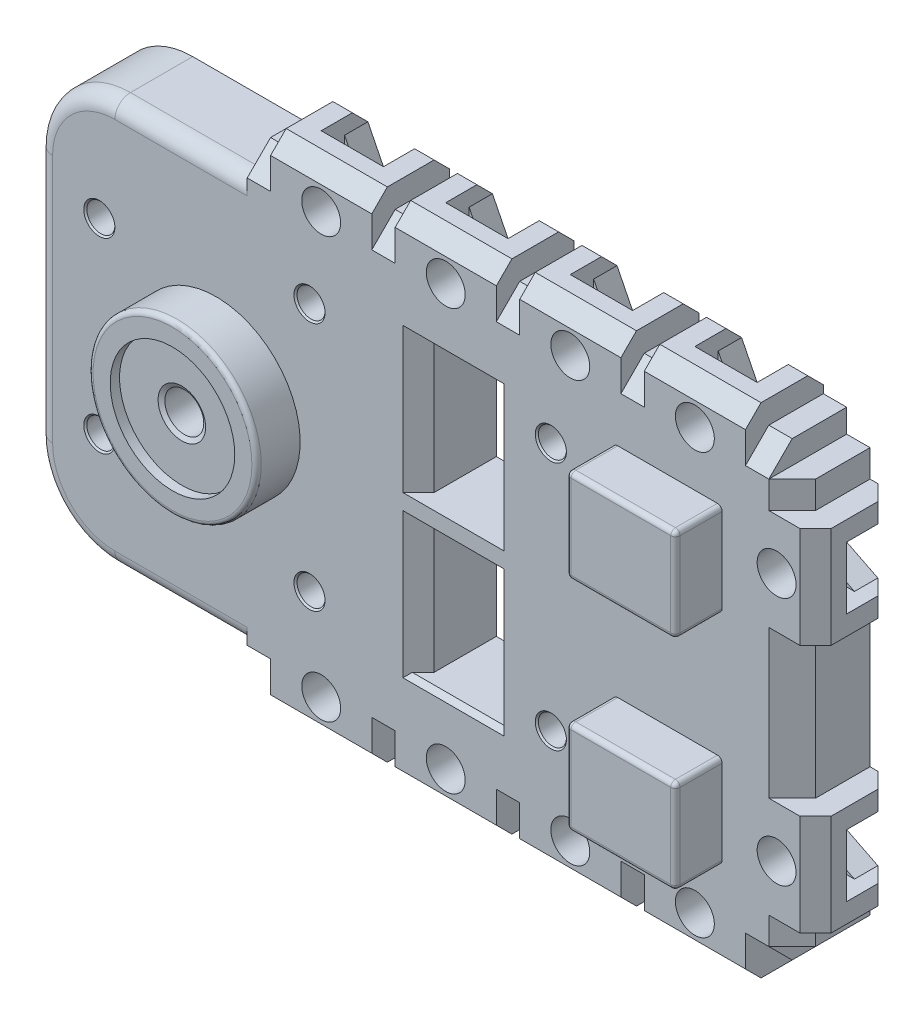
from build123d import *

# Parameters (mm, degrees)
BOSS_EXTRUDE1_DEPTH                  = 2.5
SKETCH5_W                            = 7
SKETCH5_H                            = 6
BOSS_EXTRUDE3_DEPTH                  = 3
SKETCH6_W                            = 3
SKETCH6_H                            = 4
CUT_EXTRUDE3_DEPTH                   = 1
CUT_EXTRUDE4_DEPTH                   = 1.5
CUT_EXTRUDE5_REACH                   = 44.453
SKETCH10_W                           = 4
SKETCH10_H                           = 3
CUT_EXTRUDE6_DEPTH                   = 1
CUT_EXTRUDE7_DEPTH                   = 1.5
CUT_EXTRUDE8_REACH                   = 44.453
CUT_EXTRUDE9_REACH                   = 43.991
SKETCH13_R                           = 1.25
CUT_EXTRUDE10_REACH                  = 43.991
SKETCH14_R                           = 1.25
LPATTERN1_COUNT                      = 4
LPATTERN1_PITCH                      = 8
MIRROR1_COPY_1_SKETCH_W              = 4
MIRROR1_COPY_1_SKETCH_H              = 3
MIRROR1_COPY_1_DEPTH                 = 1
MIRROR1_COPY_2_SKETCH_W              = 4
MIRROR1_COPY_2_SKETCH_H              = 3
MIRROR1_COPY_2_DEPTH                 = 1
MIRROR1_COPY_3_SKETCH_W              = 4
MIRROR1_COPY_3_SKETCH_H              = 3
MIRROR1_COPY_3_DEPTH                 = 1
MIRROR1_COPY_4_DEPTH                 = 1.5
MIRROR1_COPY_5_DEPTH                 = 1.5
MIRROR1_COPY_6_DEPTH                 = 1.5
MIRROR1_COPY_7_REACH                 = 44.453
MIRROR1_COPY_8_REACH                 = 44.453
MIRROR1_COPY_9_REACH                 = 44.453
MIRROR1_COPY_10_REACH                = 43.991
MIRROR1_COPY_10_SKETCH_R             = 1.25
MIRROR1_COPY_11_REACH                = 43.991
MIRROR1_COPY_11_SKETCH_R             = 1.25
MIRROR1_COPY_12_REACH                = 43.991
MIRROR1_COPY_12_SKETCH_R             = 1.25
FILLET1_R                            = 5
SKETCH2_W                            = 4.5
SKETCH2_H                            = 9
CUT_EXTRUDE1_DEPTH                   = 42.991070479
SKETCH3_R                            = 5.4
BOSS_EXTRUDE4_DEPTH                  = 2.8
SKETCH17_R                           = 4
CUT_EXTRUDE13_DEPTH                  = 0.6
F_1_6_1_6_DIAMETER_HOLE1_D           = 1.6
F_1_6_1_6_DIAMETER_HOLE1_DEPTH       = 4.5
F_1_6_1_6_DIAMETER_HOLE1_CSINK_D     = 1.8
F_1_6_1_6_DIAMETER_HOLE1_CSINK_ANGLE = 120
F_1_6_1_6_DIAMETER_HOLE1_TIP         = 0.480688495
M3_TAPPED_HOLE1_D                    = 2.5
M3_TAPPED_HOLE1_CSINK_D              = 3.05
M3_TAPPED_HOLE1_CSINK_ANGLE          = 120
F_1_8_1_8_DIAMETER_HOLE1_D           = 1.8
F_1_8_1_8_DIAMETER_HOLE1_CSINK_D     = 2
F_1_8_1_8_DIAMETER_HOLE1_CSINK_ANGLE = 90
FILLET2_R                            = 1
CHAMFER1_SIZE                        = 1
CHAMFER2_SIZE                        = 1.5
CHAMFER3_SIZE                        = 1
CHAMFER4_SIZE                        = 0.3
FILLET3_R                            = 0.3


with BuildPart() as part:
    # Sketch1 → Boss-Extrude1 (new, symmetric)
    with BuildSketch(Plane.XY):
        Polygon((37, -13), (35.5, -13), (35.5, -14.5), (34, -14.5), (34, -16), (27.5, -16), (27.5, -14.5), (26, -14.5), (26, -16), (19.5, -16), (19.5, -14.5), (18, -14.5), (18, -16), (11.5, -16), (11.5, -14.5), (10, -14.5), (10, -16), (3.5, -16), (3.5, -14.5), (2, -14.5), (2, -13), (-11.5, -13), (-11.5, 13), (2, 13), (2, 14.5), (3.5, 14.5), (3.5, 16), (10, 16), (10, 14.5), (11.5, 14.5), (11.5, 16), (18, 16), (18, 14.5), (19.5, 14.5), (19.5, 16), (26, 16), (26, 14.5), (27.5, 14.5), (27.5, 16), (34, 16), (34, 14.5), (35.5, 14.5), (35.5, 13), (37, 13), (37, 11.25), (38.5, 11.25), (38.5, 4.75), (37, 4.75), (37, -4.75), (38.5, -4.75), (38.5, -11.25), (37, -11.25), align=None)
    extrude(amount=BOSS_EXTRUDE1_DEPTH, both=True)

    # Sketch5 → Boss-Extrude3 (add)
    with BuildSketch(Plane.XY.offset(2.5)):
        with Locations((29, 7)):
            Rectangle(SKETCH5_W, SKETCH5_H)
        with Locations((29, -7)):
            Rectangle(SKETCH5_W, SKETCH5_H)
    extrude(amount=BOSS_EXTRUDE3_DEPTH)

    # Sketch6 → Cut-Extrude3 (cut)
    with BuildSketch(Plane(origin=(38.5, 0, 0), x_dir=(0, 0, -1), z_dir=(1, 0, 0))):
        with Locations((1, 8)):
            Rectangle(SKETCH6_W, SKETCH6_H)
    cut_extrude3 = extrude(amount=-CUT_EXTRUDE3_DEPTH, mode=Mode.SUBTRACT)

    # Sketch7 → Cut-Extrude4 (cut)
    with BuildSketch(Plane(origin=(0, 0, 0.5), x_dir=(-1, 0, 0), z_dir=(0, 0, -1))):
        Polygon((-37.154700538, 6), (-34.845299462, 6), (-33.690598923, 8), (-34.845299462, 10), (-37.154700538, 10), (-38.5, 10), (-38.5, 6), align=None)
    cut_extrude4 = extrude(amount=CUT_EXTRUDE4_DEPTH, mode=Mode.SUBTRACT)

    # Sketch8 → Cut-Extrude5 (cut, up to next)
    with BuildSketch(Plane(origin=(0, 0, -2.5), x_dir=(-1, 0, 0), z_dir=(0, 0, -1)), mode=Mode.PRIVATE) as cut_extrude5_sk1:
        Polygon((-37.5, 10), (-35.5, 9), (-35.5, 7), (-37.5, 6), align=None)
    cut_extrude5_tool1 = extrude(cut_extrude5_sk1.sketch, amount=-CUT_EXTRUDE5_REACH, mode=Mode.PRIVATE) & part.part
    cut_extrude5 = cut_extrude5_tool1.solids().sort_by_distance((36.611111, 8, -2.5))[0]
    add(cut_extrude5, mode=Mode.SUBTRACT)

    # Sketch10 → Cut-Extrude6 (cut)
    with BuildSketch(Plane(origin=(0, 16, 0), x_dir=(1, 0, 0), z_dir=(0, 1, 0))):
        with Locations((30.75, 1)):
            Rectangle(SKETCH10_W, SKETCH10_H)
    cut_extrude6 = extrude(amount=-CUT_EXTRUDE6_DEPTH, mode=Mode.SUBTRACT)

    # Sketch11 → Cut-Extrude7 (cut)
    with BuildSketch(Plane(origin=(0, 0, 0.5), x_dir=(-1, 0, 0), z_dir=(0, 0, -1))):
        Polygon((-32.75, 14.654700538), (-32.75, 12.345299462), (-30.75, 11.190598923), (-28.75, 12.345299462), (-28.75, 14.654700538), (-28.75, 16), (-32.75, 16), align=None)
    cut_extrude7 = extrude(amount=CUT_EXTRUDE7_DEPTH, mode=Mode.SUBTRACT)

    # Sketch12 → Cut-Extrude8 (cut, up to next)
    with BuildSketch(Plane(origin=(0, 0, -2.5), x_dir=(-1, 0, 0), z_dir=(0, 0, -1)), mode=Mode.PRIVATE) as cut_extrude8_sk1:
        Polygon((-28.75, 15), (-29.75, 13), (-31.75, 13), (-32.75, 15), align=None)
    cut_extrude8_tool1 = extrude(cut_extrude8_sk1.sketch, amount=-CUT_EXTRUDE8_REACH, mode=Mode.PRIVATE) & part.part
    cut_extrude8 = cut_extrude8_tool1.solids().sort_by_distance((30.75, 14.111111, -2.5))[0]
    add(cut_extrude8, mode=Mode.SUBTRACT)

    # Sketch13 → Cut-Extrude9 (cut, up to next)
    with BuildSketch(Plane.XY.offset(2.5), mode=Mode.PRIVATE) as cut_extrude9_sk1:
        with Locations((36, 8)):
            Circle(SKETCH13_R)
    cut_extrude9_tool1 = extrude(cut_extrude9_sk1.sketch, amount=-CUT_EXTRUDE9_REACH, mode=Mode.PRIVATE) & part.part
    cut_extrude9 = cut_extrude9_tool1.solids().sort_by_distance((36, 8, 2.5))[0]
    add(cut_extrude9, mode=Mode.SUBTRACT)

    # Sketch14 → Cut-Extrude10 (cut, up to next)
    with BuildSketch(Plane.XY.offset(2.5), mode=Mode.PRIVATE) as cut_extrude10_sk1:
        with Locations((30.75, 13.5)):
            Circle(SKETCH14_R)
    cut_extrude10_tool1 = extrude(cut_extrude10_sk1.sketch, amount=-CUT_EXTRUDE10_REACH, mode=Mode.PRIVATE) & part.part
    cut_extrude10 = cut_extrude10_tool1.solids().sort_by_distance((30.75, 13.5, 2.5))[0]
    add(cut_extrude10, mode=Mode.SUBTRACT)

    # LPattern1: Cut-Extrude6, Cut-Extrude7, Cut-Extrude8, Cut-Extrude10 ×4
    with Locations(*[(-i * LPATTERN1_PITCH, 0, 0) for i in range(1, LPATTERN1_COUNT)]):
        add(cut_extrude6, mode=Mode.SUBTRACT)
        add(cut_extrude7, mode=Mode.SUBTRACT)
        add(cut_extrude8, mode=Mode.SUBTRACT)
        add(cut_extrude10, mode=Mode.SUBTRACT)

    # Mirror1: Cut-Extrude3, Cut-Extrude4, Cut-Extrude5, Cut-Extrude6, Cut-Extrude7, Cut-Extrude8, Cut-Extrude9, Cut-Extrude10 across plane
    add(cut_extrude3.mirror(Plane.ZX), mode=Mode.SUBTRACT)
    add(cut_extrude4.mirror(Plane.ZX), mode=Mode.SUBTRACT)
    add(cut_extrude5.mirror(Plane.ZX), mode=Mode.SUBTRACT)
    add(cut_extrude6.mirror(Plane.ZX), mode=Mode.SUBTRACT)
    add(cut_extrude7.mirror(Plane.ZX), mode=Mode.SUBTRACT)
    add(cut_extrude8.mirror(Plane.ZX), mode=Mode.SUBTRACT)
    add(cut_extrude9.mirror(Plane.ZX), mode=Mode.SUBTRACT)
    add(cut_extrude10.mirror(Plane.ZX), mode=Mode.SUBTRACT)

    # Mirror1 copy 1 sketch → Mirror1 copy 1 (cut)
    with BuildSketch(Plane(origin=(-8, -16, 0), x_dir=(1, 0, 0), z_dir=(0, -1, 0))):
        with Locations((30.75, -1)):
            Rectangle(MIRROR1_COPY_1_SKETCH_W, MIRROR1_COPY_1_SKETCH_H)
    extrude(amount=-MIRROR1_COPY_1_DEPTH, mode=Mode.SUBTRACT)

    # Mirror1 copy 2 sketch → Mirror1 copy 2 (cut)
    with BuildSketch(Plane(origin=(-16, -16, 0), x_dir=(1, 0, 0), z_dir=(0, -1, 0))):
        with Locations((30.75, -1)):
            Rectangle(MIRROR1_COPY_2_SKETCH_W, MIRROR1_COPY_2_SKETCH_H)
    extrude(amount=-MIRROR1_COPY_2_DEPTH, mode=Mode.SUBTRACT)

    # Mirror1 copy 3 sketch → Mirror1 copy 3 (cut)
    with BuildSketch(Plane(origin=(-24, -16, 0), x_dir=(1, 0, 0), z_dir=(0, -1, 0))):
        with Locations((30.75, -1)):
            Rectangle(MIRROR1_COPY_3_SKETCH_W, MIRROR1_COPY_3_SKETCH_H)
    extrude(amount=-MIRROR1_COPY_3_DEPTH, mode=Mode.SUBTRACT)

    # Mirror1 copy 4 sketch → Mirror1 copy 4 (cut)
    with BuildSketch(Plane(origin=(-8, 0, 0.5), x_dir=(-1, 0, 0), z_dir=(0, 0, -1))):
        Polygon((-32.75, -14.654700538), (-32.75, -12.345299462), (-30.75, -11.190598923), (-28.75, -12.345299462), (-28.75, -14.654700538), (-28.75, -16), (-32.75, -16), align=None)
    extrude(amount=MIRROR1_COPY_4_DEPTH, mode=Mode.SUBTRACT)

    # Mirror1 copy 5 sketch → Mirror1 copy 5 (cut)
    with BuildSketch(Plane(origin=(-16, 0, 0.5), x_dir=(-1, 0, 0), z_dir=(0, 0, -1))):
        Polygon((-32.75, -14.654700538), (-32.75, -12.345299462), (-30.75, -11.190598923), (-28.75, -12.345299462), (-28.75, -14.654700538), (-28.75, -16), (-32.75, -16), align=None)
    extrude(amount=MIRROR1_COPY_5_DEPTH, mode=Mode.SUBTRACT)

    # Mirror1 copy 6 sketch → Mirror1 copy 6 (cut)
    with BuildSketch(Plane(origin=(-24, 0, 0.5), x_dir=(-1, 0, 0), z_dir=(0, 0, -1))):
        Polygon((-32.75, -14.654700538), (-32.75, -12.345299462), (-30.75, -11.190598923), (-28.75, -12.345299462), (-28.75, -14.654700538), (-28.75, -16), (-32.75, -16), align=None)
    extrude(amount=MIRROR1_COPY_6_DEPTH, mode=Mode.SUBTRACT)

    # Mirror1 copy 7 sketch → Mirror1 copy 7 (cut, up to next)
    with BuildSketch(Plane(origin=(-8, 0, -2.5), x_dir=(-1, 0, 0), z_dir=(0, 0, -1)), mode=Mode.PRIVATE) as mirror1_copy_7_sk1:
        Polygon((-28.75, -15), (-29.75, -13), (-31.75, -13), (-32.75, -15), align=None)
    mirror1_copy_7_tool1 = extrude(mirror1_copy_7_sk1.sketch, amount=-MIRROR1_COPY_7_REACH, mode=Mode.PRIVATE) & part.part
    add(mirror1_copy_7_tool1.solids().sort_by_distance((22.75, -14.111111, -2.5))[0], mode=Mode.SUBTRACT)

    # Mirror1 copy 8 sketch → Mirror1 copy 8 (cut, up to next)
    with BuildSketch(Plane(origin=(-16, 0, -2.5), x_dir=(-1, 0, 0), z_dir=(0, 0, -1)), mode=Mode.PRIVATE) as mirror1_copy_8_sk1:
        Polygon((-28.75, -15), (-29.75, -13), (-31.75, -13), (-32.75, -15), align=None)
    mirror1_copy_8_tool1 = extrude(mirror1_copy_8_sk1.sketch, amount=-MIRROR1_COPY_8_REACH, mode=Mode.PRIVATE) & part.part
    add(mirror1_copy_8_tool1.solids().sort_by_distance((14.75, -14.111111, -2.5))[0], mode=Mode.SUBTRACT)

    # Mirror1 copy 9 sketch → Mirror1 copy 9 (cut, up to next)
    with BuildSketch(Plane(origin=(-24, 0, -2.5), x_dir=(-1, 0, 0), z_dir=(0, 0, -1)), mode=Mode.PRIVATE) as mirror1_copy_9_sk1:
        Polygon((-28.75, -15), (-29.75, -13), (-31.75, -13), (-32.75, -15), align=None)
    mirror1_copy_9_tool1 = extrude(mirror1_copy_9_sk1.sketch, amount=-MIRROR1_COPY_9_REACH, mode=Mode.PRIVATE) & part.part
    add(mirror1_copy_9_tool1.solids().sort_by_distance((6.75, -14.111111, -2.5))[0], mode=Mode.SUBTRACT)

    # Mirror1 copy 10 sketch → Mirror1 copy 10 (cut, up to next)
    with BuildSketch(Plane(origin=(-8, 0, 2.5), x_dir=(1, 0, 0), z_dir=(0, 0, 1)), mode=Mode.PRIVATE) as mirror1_copy_10_sk1:
        with Locations((30.75, -13.5)):
            Circle(MIRROR1_COPY_10_SKETCH_R)
    mirror1_copy_10_tool1 = extrude(mirror1_copy_10_sk1.sketch, amount=-MIRROR1_COPY_10_REACH, mode=Mode.PRIVATE) & part.part
    add(mirror1_copy_10_tool1.solids().sort_by_distance((22.75, -13.5, 2.5))[0], mode=Mode.SUBTRACT)

    # Mirror1 copy 11 sketch → Mirror1 copy 11 (cut, up to next)
    with BuildSketch(Plane(origin=(-16, 0, 2.5), x_dir=(1, 0, 0), z_dir=(0, 0, 1)), mode=Mode.PRIVATE) as mirror1_copy_11_sk1:
        with Locations((30.75, -13.5)):
            Circle(MIRROR1_COPY_11_SKETCH_R)
    mirror1_copy_11_tool1 = extrude(mirror1_copy_11_sk1.sketch, amount=-MIRROR1_COPY_11_REACH, mode=Mode.PRIVATE) & part.part
    add(mirror1_copy_11_tool1.solids().sort_by_distance((14.75, -13.5, 2.5))[0], mode=Mode.SUBTRACT)

    # Mirror1 copy 12 sketch → Mirror1 copy 12 (cut, up to next)
    with BuildSketch(Plane(origin=(-24, 0, 2.5), x_dir=(1, 0, 0), z_dir=(0, 0, 1)), mode=Mode.PRIVATE) as mirror1_copy_12_sk1:
        with Locations((30.75, -13.5)):
            Circle(MIRROR1_COPY_12_SKETCH_R)
    mirror1_copy_12_tool1 = extrude(mirror1_copy_12_sk1.sketch, amount=-MIRROR1_COPY_12_REACH, mode=Mode.PRIVATE) & part.part
    add(mirror1_copy_12_tool1.solids().sort_by_distance((6.75, -13.5, 2.5))[0], mode=Mode.SUBTRACT)

    # Fillet1
    fillet1_edges = [part.edges().sort_by_distance(p)[0] for p in [
        (-11.5, -13, 0),
        (-11.5, 13, 0),
    ]]
    fillet(fillet1_edges, radius=FILLET1_R)

    # Sketch2 → Cut-Extrude1 (cut, through all)
    with BuildSketch(Plane.XY.offset(2.5)):
        with Locations((15.25, 5)):
            Rectangle(SKETCH2_W, SKETCH2_H)
        with Locations((15.25, -5)):
            Rectangle(SKETCH2_W, SKETCH2_H)
    extrude(amount=-CUT_EXTRUDE1_DEPTH, mode=Mode.SUBTRACT)

    # Sketch3 → Boss-Extrude4 (add)
    with BuildSketch(Plane.XY.offset(2.5)):
        Circle(SKETCH3_R)
    extrude(amount=BOSS_EXTRUDE4_DEPTH)

    # Sketch17 → Cut-Extrude13 (cut)
    with BuildSketch(Plane.XY.offset(5.3)):
        Circle(SKETCH17_R)
    extrude(amount=-CUT_EXTRUDE13_DEPTH, mode=Mode.SUBTRACT)

    # Ø1.6 (1.6) Diameter Hole1
    with Locations(Plane(origin=(0, 0, -2.5), x_dir=(-1, 0, 0), z_dir=(0, 0, -1))):
        with Locations((-33, 10.4), (-33, -10.4), (9, 9.25), (9, -9.25)):
            CounterSinkHole(F_1_6_1_6_DIAMETER_HOLE1_D / 2, F_1_6_1_6_DIAMETER_HOLE1_CSINK_D / 2, depth=F_1_6_1_6_DIAMETER_HOLE1_DEPTH, counter_sink_angle=F_1_6_1_6_DIAMETER_HOLE1_CSINK_ANGLE)
            with Locations((0, 0, -(F_1_6_1_6_DIAMETER_HOLE1_DEPTH + F_1_6_1_6_DIAMETER_HOLE1_TIP / 2))):  # 118° drill point
                Cone(0, F_1_6_1_6_DIAMETER_HOLE1_D / 2, F_1_6_1_6_DIAMETER_HOLE1_TIP, mode=Mode.SUBTRACT)

    # M3 Tapped Hole1 (through all)
    with Locations(Plane.XY.offset(4.7)):
        with Locations((0, 0)):
            CounterSinkHole(M3_TAPPED_HOLE1_D / 2, M3_TAPPED_HOLE1_CSINK_D / 2, counter_sink_angle=M3_TAPPED_HOLE1_CSINK_ANGLE)

    # Ø1.8 (1.8) Diameter Hole1 (through all)
    with Locations(Plane.XY.offset(2.5)):
        with Locations((6, 8), (21.5, 8), (-7.5, 6), (21.5, -8), (6, -8), (-7.5, -6)):
            CounterSinkHole(F_1_8_1_8_DIAMETER_HOLE1_D / 2, F_1_8_1_8_DIAMETER_HOLE1_CSINK_D / 2, counter_sink_angle=F_1_8_1_8_DIAMETER_HOLE1_CSINK_ANGLE)

    # Fillet2
    fillet2_edges = [part.edges().sort_by_distance(p)[0] for p in [
        (-2.25, 13, 2.5),
        (-10.035533906, 11.535533906, 2.5),
        (-11.5, 0, 2.5),
        (-10.035533906, -11.535533906, 2.5),
        (-2.25, -13, 2.5),
    ]]
    fillet(fillet2_edges, radius=FILLET2_R)

    # Chamfer1
    chamfer1_edges = [part.edges().sort_by_distance(p)[0] for p in [
        (4.125, -16, -2.5),
        (9.375, -16, -2.5),
        (12.125, -16, -2.5),
        (17.375, -16, -2.5),
        (20.125, -16, -2.5),
        (25.375, -16, -2.5),
        (28.125, -16, -2.5),
        (33.375, -16, -2.5),
        (4.125, 16, -2.5),
        (9.375, 16, -2.5),
        (12.125, 16, -2.5),
        (17.375, 16, -2.5),
        (20.125, 16, -2.5),
        (25.375, 16, -2.5),
        (28.125, 16, -2.5),
        (33.375, 16, -2.5),
        (38.5, -10.625, -2.5),
        (38.5, -5.375, -2.5),
        (38.5, 5.375, -2.5),
        (38.5, 10.625, -2.5),
        (6.75, 16, 2.5),
        (14.75, 16, 2.5),
        (22.75, 16, 2.5),
        (30.75, 16, 2.5),
        (38.5, 8, 2.5),
        (38.5, -8, 2.5),
        (30.75, -16, 2.5),
        (22.75, -16, 2.5),
        (14.75, -16, 2.5),
        (6.75, -16, 2.5),
    ]]
    chamfer(chamfer1_edges, length=CHAMFER1_SIZE)

    # Chamfer2
    chamfer2_edges = [part.edges().sort_by_distance(p)[0] for p in [
        (2.75, 14.5, 2.5),
        (10.75, 14.5, 2.5),
        (18.75, 14.5, 2.5),
        (26.75, 14.5, 2.5),
        (34.75, 14.5, 2.5),
        (37, 12.125, 2.5),
        (2.75, -14.5, 2.5),
        (10.75, -14.5, 2.5),
        (18.75, -14.5, 2.5),
        (26.75, -14.5, 2.5),
        (37, -12.125, 2.5),
        (34.75, -14.5, 2.5),
        (37, 0, 2.5),
    ]]
    chamfer(chamfer2_edges, length=CHAMFER2_SIZE)

    # Chamfer3
    chamfer3_edges = [part.edges().sort_by_distance(p)[0] for p in [
        (13, 5, 2.5),
        (17.5, 5, 2.5),
        (17.5, -5, 2.5),
        (13, -5, 2.5),
    ]]
    chamfer(chamfer3_edges, length=CHAMFER3_SIZE)

    # Chamfer4
    chamfer4_edges = [part.edges().sort_by_distance(p)[0] for p in [
        (15.25, 9.5, 2.5),
        (15.25, -9.5, 2.5),
    ]]
    chamfer(chamfer4_edges, length=CHAMFER4_SIZE)

    # Fillet3
    fillet3_edges = [part.edges().sort_by_distance(p)[0] for p in [
        (29, 4, 5.5),
        (25.5, 7, 5.5),
        (29, 10, 5.5),
        (32.5, 7, 5.5),
        (25.5, -7, 5.5),
        (29, -4, 5.5),
        (32.5, -7, 5.5),
        (29, -10, 5.5),
        (-5.4, 0, 5.3),
        (25.5, 10, 4),
        (32.5, 10, 4),
        (32.5, 4, 4),
        (25.5, 4, 4),
        (25.5, -4, 4),
        (32.5, -4, 4),
        (32.5, -10, 4),
        (25.5, -10, 4),
    ]]
    fillet(fillet3_edges, radius=FILLET3_R)


solid = part.part
